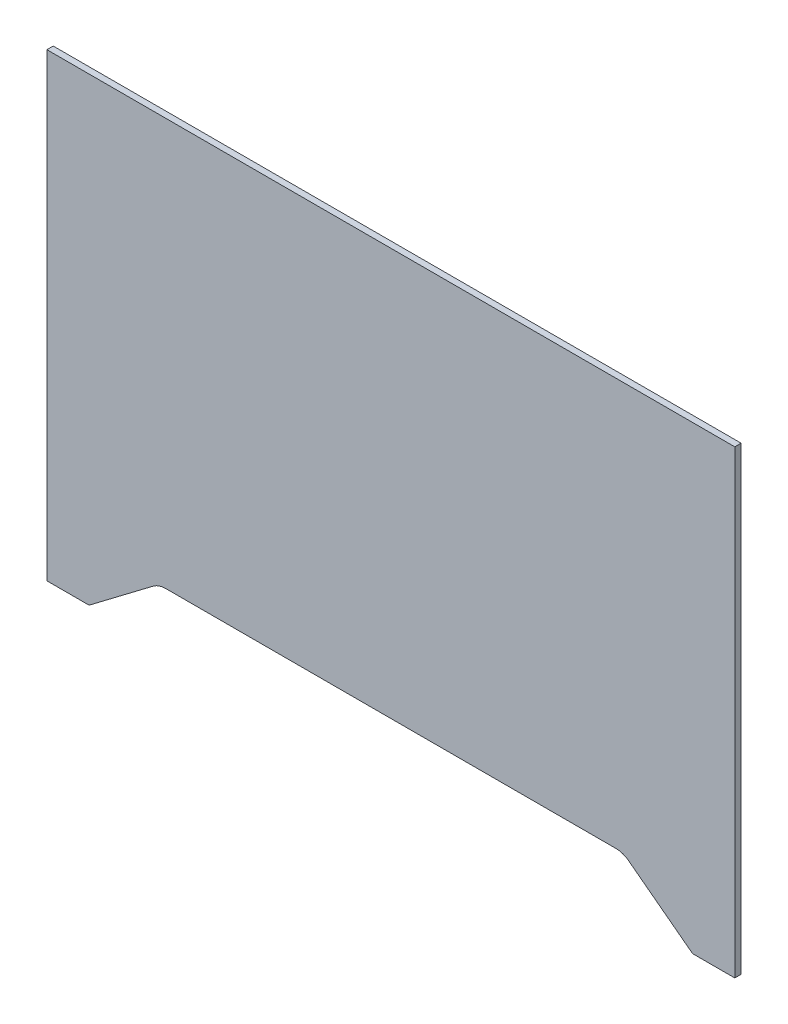
from build123d import *

# Parameters (mm, degrees)
BOSS_EXTRUDE1_DEPTH = 3


with BuildPart() as part:
    # Sketch1 → Boss-Extrude1 (new body)
    with BuildSketch(Plane.XY):
        with BuildLine():
            Line((-163, -109), (-163, 109))
            Line((-163, 109), (163, 109))
            Line((163, 109), (163, -109))
            Line((163, -109), (143, -109))
            Line((143, -109), (112.678383644, -86.029078518))
            ThreePointArc((112.678383644, -86.029078518), (109.824990055, -84.520832979), (106.639806764, -84))
            Line((106.639806764, -84), (-106.639806764, -84))
            ThreePointArc((-106.639806764, -84), (-109.824990055, -84.520832979), (-112.678383644, -86.029078518))
            Line((-112.678383644, -86.029078518), (-143, -109))
            Line((-143, -109), (-163, -109))
        make_face()
    extrude(amount=BOSS_EXTRUDE1_DEPTH)


solid = part.part
